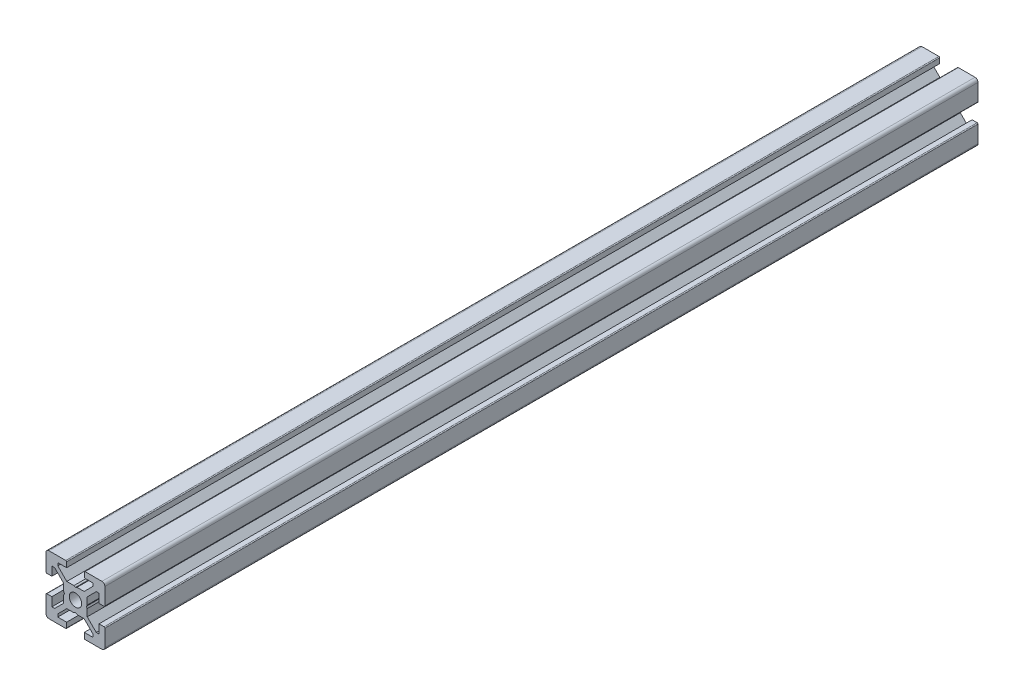
from build123d import *

# Parameters (mm, degrees)
BOSS_EXTRUDE1_DEPTH = 296.5
SKETCH2_W           = 355
SKETCH2_H           = 2.1


with BuildPart() as part:
    # Sketch1 → Boss-Extrude1 (new body)
    with BuildSketch(Plane.XY):
        with BuildLine():
            Line((-10, 9), (-10, 3.29999995))
            ThreePointArc((-10, 3.29999995), (-9.912132049, 3.087867916), (-9.7, 3))
            Line((-9.7, 3), (-8, 3))
            Line((-8, 3), (-8, 6))
            Line((-8, 6), (-7.060677, 6))
            Line((-7.060677, 6), (-4, 2.93932965))
            Line((-4, 2.93932965), (-4, 0.519615242))
            Line((-4, 0.519615242), (-3.699996283, -6.437e-06))
            Line((-3.699996283, -6.437e-06), (-4, -0.519628117))
            Line((-4, -0.519628117), (-4, -2.93933725))
            Line((-4, -2.93933725), (-7.0606695, -6))
            Line((-7.0606695, -6), (-8, -6))
            Line((-8, -6), (-8, -3))
            Line((-8, -3), (-9.7, -3))
            ThreePointArc((-9.7, -3), (-9.912132049, -3.087867916), (-10, -3.29999995))
            Line((-10, -3.29999995), (-10, -9))
            ThreePointArc((-10, -9), (-9.707106781, -9.707106781), (-9, -10))
            Line((-9, -10), (-3.29999995, -10))
            ThreePointArc((-3.29999995, -10), (-3.087867916, -9.912132049), (-3, -9.7))
            Line((-3, -9.7), (-3, -8))
            Line((-3, -8), (-6, -8))
            Line((-6, -8), (-6, -7.0606515))
            Line((-6, -7.0606515), (-2.9393489, -4))
            Line((-2.9393489, -4), (-0.519615242, -4))
            Line((-0.519615242, -4), (6.437e-06, -3.699996283))
            Line((6.437e-06, -3.699996283), (0.519628117, -4))
            Line((0.519628117, -4), (2.9393227, -4))
            Line((2.9393227, -4), (6, -7.060677))
            Line((6, -7.060677), (6, -8))
            Line((6, -8), (3, -8))
            Line((3, -8), (3, -9.7))
            ThreePointArc((3, -9.7), (3.087867916, -9.912132049), (3.29999995, -10))
            Line((3.29999995, -10), (9, -10))
            ThreePointArc((9, -10), (9.707106781, -9.707106781), (10, -9))
            Line((10, -9), (10, -3.29999995))
            ThreePointArc((10, -3.29999995), (9.912132049, -3.087867916), (9.7, -3))
            Line((9.7, -3), (8, -3))
            Line((8, -3), (8, -6))
            Line((8, -6), (7.0606435, -6))
            Line((7.0606435, -6), (4, -2.9393482))
            Line((4, -2.9393482), (4, -0.519615242))
            Line((4, -0.519615242), (3.699996283, 6.437e-06))
            Line((3.699996283, 6.437e-06), (4, 0.519628117))
            Line((4, 0.519628117), (4, 2.9393401))
            Line((4, 2.9393401), (7.060651, 6))
            Line((7.060651, 6), (8, 6))
            Line((8, 6), (8, 3))
            Line((8, 3), (9.7, 3))
            ThreePointArc((9.7, 3), (9.912132049, 3.087867916), (10, 3.29999995))
            Line((10, 3.29999995), (10, 9))
            ThreePointArc((10, 9), (9.707106781, 9.707106781), (9, 10))
            Line((9, 10), (3.29999995, 10))
            ThreePointArc((3.29999995, 10), (3.087867916, 9.912132049), (3, 9.7))
            Line((3, 9.7), (3, 8))
            Line((3, 8), (6, 8))
            Line((6, 8), (6, 7.060669))
            Line((6, 7.060669), (2.9393308, 4))
            Line((2.9393308, 4), (0.519615242, 4))
            Line((0.519615242, 4), (-6.437e-06, 3.699996283))
            Line((-6.437e-06, 3.699996283), (-0.519628117, 4))
            Line((-0.519628117, 4), (-2.93935655, 4))
            Line((-2.93935655, 4), (-6, 7.0606435))
            Line((-6, 7.0606435), (-6, 8))
            Line((-6, 8), (-3, 8))
            Line((-3, 8), (-3, 9.7))
            ThreePointArc((-3, 9.7), (-3.087867966, 9.912132034), (-3.3, 10))
            Line((-3.3, 10), (-9, 10))
            ThreePointArc((-9, 10), (-9.707106781, 9.707106781), (-10, 9))
        make_face()
    extrude(amount=-BOSS_EXTRUDE1_DEPTH)

    # Sketch2 → Cut-Revolve1 (revolve, cut)
    with BuildSketch(Plane(origin=(0, 0, 0), x_dir=(0, 0, -1), z_dir=(1, 0, 0))):
        with Locations((177.5, 1.05)):
            Rectangle(SKETCH2_W, SKETCH2_H)
    revolve(axis=Axis((0, 0, -355), (0, 0, 1)), mode=Mode.SUBTRACT)


solid = part.part
